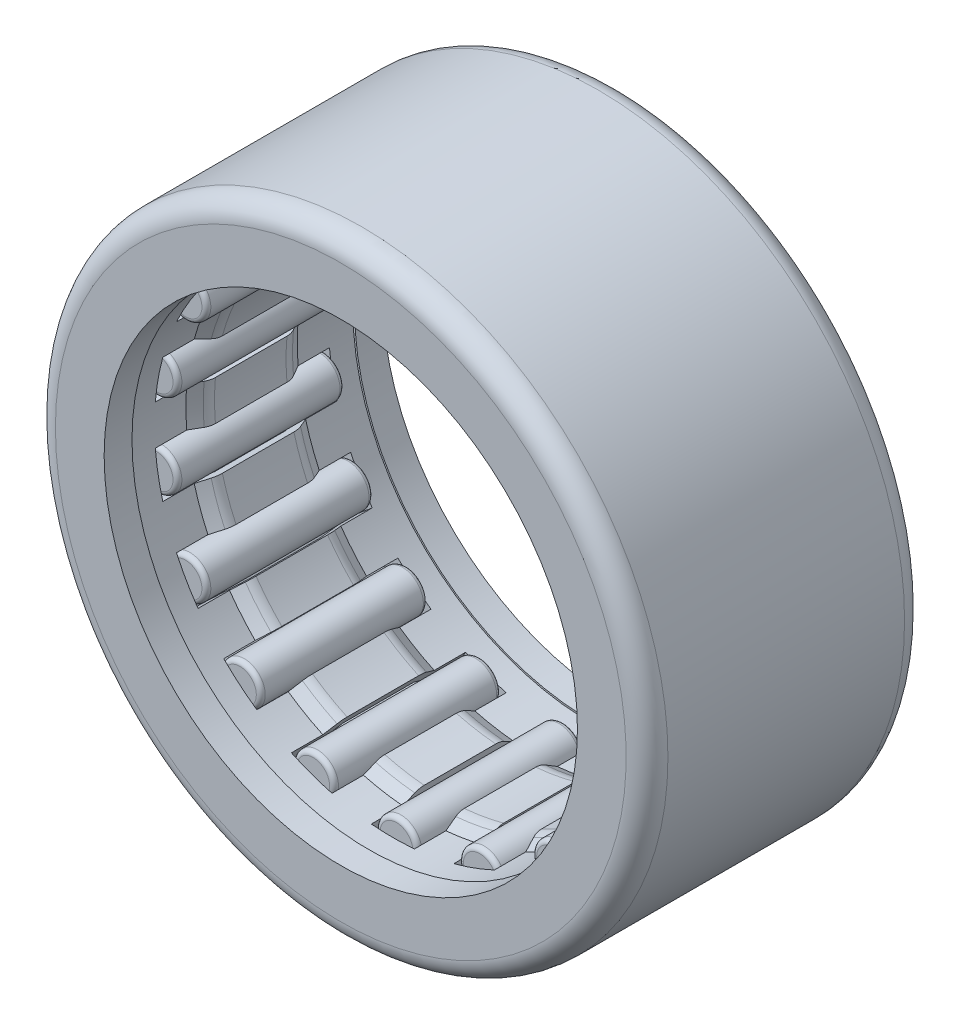
from build123d import *

# Parameters (mm, degrees)
FILLET1_R          = 0.5953125
SKETCH4_W          = 4.7625
SKETCH4_H          = 0.5953125
FILLET2_R          = 0.127
CIRPATTERN1_COUNT  = 18
FILLET3_R          = 0.508
CUT_EXTRUDE1_DEPTH = 2.48285
CIRPATTERN2_COUNT  = 18


with BuildPart() as part:
    # Sketch3 → Revolve1 (revolve)
    with BuildSketch(Plane(origin=(0, 0, 0), x_dir=(0, 0, -1), z_dir=(1, 0, 0)), mode=Mode.PRIVATE) as revolve1_sk:
        Polygon((3.175, 7.9375), (3.175, 6.746875), (3.96875, 6.746875), (3.96875, 8.73125), (-3.96875, 8.73125), (-3.96875, 6.746875), (-3.175, 6.746875), (-3.175, 7.9375), align=None)
    revolve(revolve1_sk.sketch.rotate(Axis((0, 0, 3.96875), (0, 0, -1)), 90), axis=Axis((0, 0, 3.96875), (0, 0, -1)))

    # Fillet1
    fillet1_edges = [part.edges().sort_by_distance(p)[0] for p in [
        (-8.73125, 0, -3.96875),
        (-8.73125, 0, 3.96875),
    ]]
    fillet(fillet1_edges, radius=FILLET1_R)


with BuildPart() as body_2:
    # Sketch4 → Revolve2 (revolve)
    with BuildSketch(Plane(origin=(0, 0, 0), x_dir=(0, 0, -1), z_dir=(1, 0, 0))):
        with Locations((0, 6.64765625)):
            Rectangle(SKETCH4_W, SKETCH4_H)
    revolve(axis=Axis((0, 6.9453125, 2.38125), (0, 0, -1)))

    # Fillet2
    fillet2_edges = [body_2.edges().sort_by_distance(p)[0] for p in [
        (0, 7.540625, 2.38125),
        (0, 7.540625, -2.38125),
    ]]
    fillet(fillet2_edges, radius=FILLET2_R)


with BuildPart() as cirpattern1_1:
    # CirPattern1: pattern copy
    add(body_2.part.rotate(Axis((0, 0, 0), (0, 0, 1)), 1 * 360 / CIRPATTERN1_COUNT))


with BuildPart() as cirpattern1_2:
    # CirPattern1: pattern copy
    add(body_2.part.rotate(Axis((0, 0, 0), (0, 0, 1)), 2 * 360 / CIRPATTERN1_COUNT))


with BuildPart() as cirpattern1_3:
    # CirPattern1: pattern copy
    add(body_2.part.rotate(Axis((0, 0, 0), (0, 0, 1)), 3 * 360 / CIRPATTERN1_COUNT))


with BuildPart() as cirpattern1_4:
    # CirPattern1: pattern copy
    add(body_2.part.rotate(Axis((0, 0, 0), (0, 0, 1)), 4 * 360 / CIRPATTERN1_COUNT))


with BuildPart() as cirpattern1_5:
    # CirPattern1: pattern copy
    add(body_2.part.rotate(Axis((0, 0, 0), (0, 0, 1)), 5 * 360 / CIRPATTERN1_COUNT))


with BuildPart() as cirpattern1_6:
    # CirPattern1: pattern copy
    add(body_2.part.rotate(Axis((0, 0, 0), (0, 0, 1)), 6 * 360 / CIRPATTERN1_COUNT))


with BuildPart() as cirpattern1_7:
    # CirPattern1: pattern copy
    add(body_2.part.rotate(Axis((0, 0, 0), (0, 0, 1)), 7 * 360 / CIRPATTERN1_COUNT))


with BuildPart() as cirpattern1_8:
    # CirPattern1: pattern copy
    add(body_2.part.rotate(Axis((0, 0, 0), (0, 0, 1)), 8 * 360 / CIRPATTERN1_COUNT))


with BuildPart() as cirpattern1_9:
    # CirPattern1: pattern copy
    add(body_2.part.rotate(Axis((0, 0, 0), (0, 0, 1)), 9 * 360 / CIRPATTERN1_COUNT))


with BuildPart() as cirpattern1_10:
    # CirPattern1: pattern copy
    add(body_2.part.rotate(Axis((0, 0, 0), (0, 0, 1)), 10 * 360 / CIRPATTERN1_COUNT))


with BuildPart() as cirpattern1_11:
    # CirPattern1: pattern copy
    add(body_2.part.rotate(Axis((0, 0, 0), (0, 0, 1)), 11 * 360 / CIRPATTERN1_COUNT))


with BuildPart() as cirpattern1_12:
    # CirPattern1: pattern copy
    add(body_2.part.rotate(Axis((0, 0, 0), (0, 0, 1)), 12 * 360 / CIRPATTERN1_COUNT))


with BuildPart() as cirpattern1_13:
    # CirPattern1: pattern copy
    add(body_2.part.rotate(Axis((0, 0, 0), (0, 0, 1)), 13 * 360 / CIRPATTERN1_COUNT))


with BuildPart() as cirpattern1_14:
    # CirPattern1: pattern copy
    add(body_2.part.rotate(Axis((0, 0, 0), (0, 0, 1)), 14 * 360 / CIRPATTERN1_COUNT))


with BuildPart() as cirpattern1_15:
    # CirPattern1: pattern copy
    add(body_2.part.rotate(Axis((0, 0, 0), (0, 0, 1)), 15 * 360 / CIRPATTERN1_COUNT))


with BuildPart() as cirpattern1_16:
    # CirPattern1: pattern copy
    add(body_2.part.rotate(Axis((0, 0, 0), (0, 0, 1)), 16 * 360 / CIRPATTERN1_COUNT))


with BuildPart() as cirpattern1_17:
    # CirPattern1: pattern copy
    add(body_2.part.rotate(Axis((0, 0, 0), (0, 0, 1)), 17 * 360 / CIRPATTERN1_COUNT))


with BuildPart() as body_20:
    # Sketch6 → Revolve3 (revolve)
    with BuildSketch(Plane(origin=(0, 0, 0), x_dir=(0, 0, -1), z_dir=(1, 0, 0)), mode=Mode.PRIVATE) as revolve3_sk:
        Polygon((-3.175, 6.797675), (-3.175, 7.3421875), (-1.955033964, 7.3421875), (-1.011910649, 6.797675), (1.011910649, 6.797675), (1.955033964, 7.3421875), (3.175, 7.3421875), (3.175, 6.797675), (1.5875, 6.797675), (1.155807987, 6.5484375), (-1.155807987, 6.5484375), (-1.5875, 6.797675), align=None)
    revolve(revolve3_sk.sketch.rotate(Axis((0, 0, 3.96875), (0, 0, -1)), 90), axis=Axis((0, 0, 3.96875), (0, 0, -1)))

    # Fillet3
    fillet3_edges = [body_20.edges().sort_by_distance(p)[0] for p in [
        (-6.5484375, 0, -1.155807987),
        (-6.5484375, 0, 1.155807987),
    ]]
    fillet(fillet3_edges, radius=FILLET3_R)

    # Sketch7 → Cut-Extrude1 (cut, symmetric)
    with BuildSketch(Plane.XY):
        Polygon((-0.532185434, 6.2992), (0.532185434, 6.2992), (0.760039566, 7.591425), (-0.760039566, 7.591425), align=None)
    cut_extrude1 = extrude(amount=CUT_EXTRUDE1_DEPTH, both=True, mode=Mode.SUBTRACT)

    # CirPattern2: Cut-Extrude1 ×18 about axis
    cirpattern2_axis = Axis((0, 0, 0), (0, 0, 1))
    for i in range(1, CIRPATTERN2_COUNT):
        add(cut_extrude1.rotate(cirpattern2_axis, i * 360 / CIRPATTERN2_COUNT), mode=Mode.SUBTRACT)


solid = Compound([part.part, body_2.part, cirpattern1_1.part, cirpattern1_2.part, cirpattern1_3.part, cirpattern1_4.part, cirpattern1_5.part, cirpattern1_6.part, cirpattern1_7.part, cirpattern1_8.part, cirpattern1_9.part, cirpattern1_10.part, cirpattern1_11.part, cirpattern1_12.part, cirpattern1_13.part, cirpattern1_14.part, cirpattern1_15.part, cirpattern1_16.part, cirpattern1_17.part, body_20.part])
